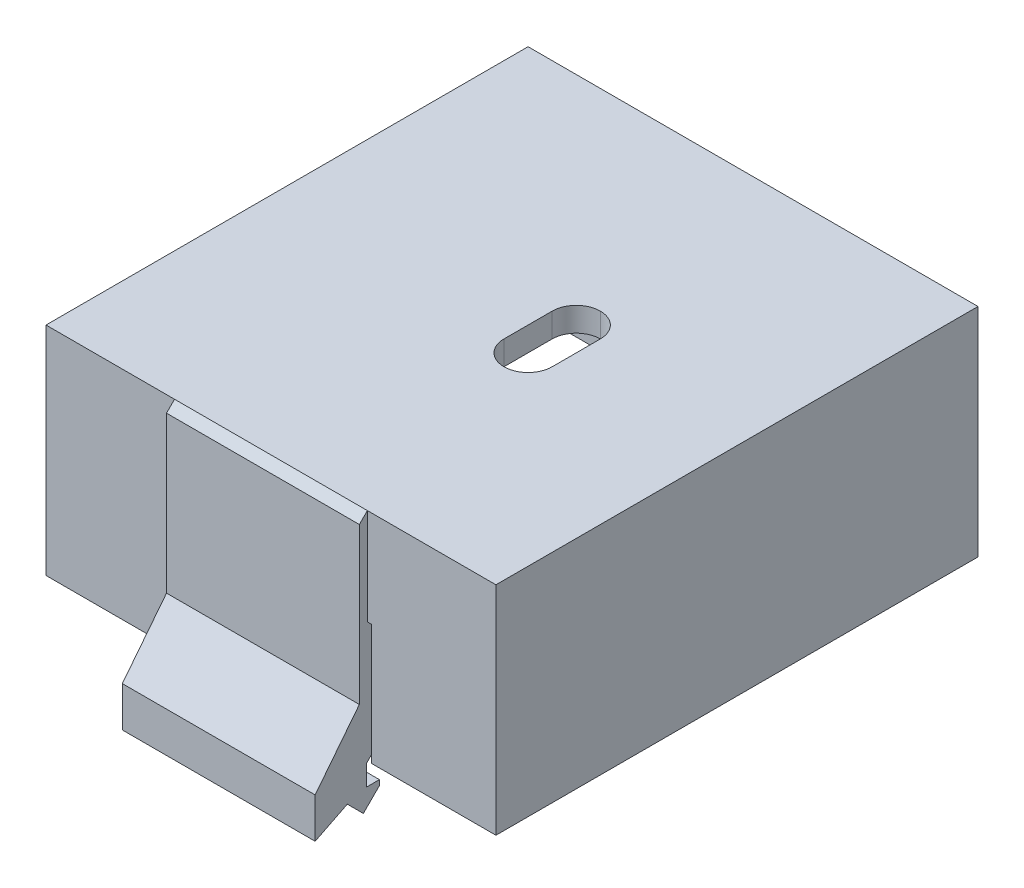
from build123d import *

# Parameters (mm, degrees)
SKETCH1_W           = 56
SKETCH1_H           = 60
SKETCH1_W_2         = 50
SKETCH1_H_2         = 54
BOSS_EXTRUDE1_DEPTH = 24
SKETCH2_W           = 56
SKETCH2_H           = 60
BOSS_EXTRUDE2_DEPTH = 3
CUT_EXTRUDE1_DEPTH  = 12.5
BOSS_EXTRUDE3_DEPTH = 12
SKETCH5_W           = 53.4
SKETCH5_H           = 57.4
SKETCH5_W_2         = 50
SKETCH5_H_2         = 54
CUT_EXTRUDE2_DEPTH  = 5.5
CUT_EXTRUDE3_REACH  = 58.267
SKETCH6_W           = 6
SKETCH6_H           = 12
FILLET3_R           = 3


with BuildPart() as part:
    # Sketch1 → Boss-Extrude1 (new body)
    with BuildSketch(Plane(origin=(0, 9.820251789, 0), x_dir=(1, 0, 0), z_dir=(0, 1, 0))):
        Rectangle(SKETCH1_W, SKETCH1_H)
        Rectangle(SKETCH1_W_2, SKETCH1_H_2, mode=Mode.SUBTRACT)
    extrude(amount=BOSS_EXTRUDE1_DEPTH)

    # Sketch2 → Boss-Extrude2 (add)
    with BuildSketch(Plane(origin=(0, 33.820251789, 0), x_dir=(1, 0, 0), z_dir=(0, 1, 0))):
        Rectangle(SKETCH2_W, SKETCH2_H)
    extrude(amount=BOSS_EXTRUDE2_DEPTH)

    # Sketch3 → Cut-Extrude1 (cut, symmetric)
    with BuildSketch(Plane(origin=(0, 0, 0), x_dir=(0, 0, -1), z_dir=(1, 0, 0))):
        Polygon((28.5, 9.820251789), (28.5, 23.320251789), (30, 24.820251789), (30, 9.820251789), align=None)
    cut_extrude1 = extrude(amount=CUT_EXTRUDE1_DEPTH, both=True, mode=Mode.SUBTRACT)

    # Sketch4 → Boss-Extrude3 (add, symmetric)
    with BuildSketch(Plane(origin=(0, 0, 0), x_dir=(0, 0, -1), z_dir=(1, 0, 0))):
        Polygon((30.1, 7.070251789), (28.5, 7.070251789), (28.5, 6.420251789), (30.5, 4.420251789), (32.5, 6.420251789), (36.5, 4.420251789), (36.5, 9.420251789), (31, 16.420251789), (31, 35.820251789), (30, 36.820251789), (29, 36.820251789), (29, 10.734465351), (30.1, 9.634465351), align=None)
    boss_extrude3 = extrude(amount=BOSS_EXTRUDE3_DEPTH, both=True)

    # Sketch5 → Cut-Extrude2 (cut)
    with BuildSketch(Plane.XZ.offset(-9.820251789)):
        Rectangle(SKETCH5_W, SKETCH5_H)
        Rectangle(SKETCH5_W_2, SKETCH5_H_2, mode=Mode.SUBTRACT)
    extrude(amount=-CUT_EXTRUDE2_DEPTH, mode=Mode.SUBTRACT)

    # Mirror1: Cut-Extrude1, Boss-Extrude3 across plane
    add(cut_extrude1.mirror(Plane.XY), mode=Mode.SUBTRACT)
    add(boss_extrude3.mirror(Plane.XY))

    # Sketch6 → Cut-Extrude3 (cut, up to next)
    with BuildSketch(Plane(origin=(0, 36.820251789, 0), x_dir=(1, 0, 0), z_dir=(0, 1, 0)), mode=Mode.PRIVATE) as cut_extrude3_sk1:
        with Locations((5, 0)):
            Rectangle(SKETCH6_W, SKETCH6_H)
    cut_extrude3_tool1 = extrude(cut_extrude3_sk1.sketch, amount=-CUT_EXTRUDE3_REACH, mode=Mode.PRIVATE) & part.part
    add(cut_extrude3_tool1.solids().sort_by_distance((5, 36.820252, 0))[0], mode=Mode.SUBTRACT)

    # Fillet3
    fillet3_edges = [part.edges().sort_by_distance(p)[0] for p in [
        (2, 35.320251789, 6),
        (8, 35.320251789, 6),
        (8, 35.320251789, -6),
        (2, 35.320251789, -6),
    ]]
    fillet(fillet3_edges, radius=FILLET3_R - 0.0001)  # a hair under: the kernel refuses the full size


solid = part.part
